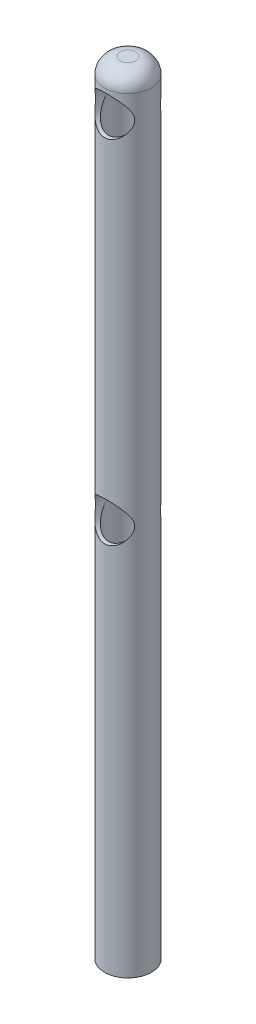
from build123d import *

# Parameters (mm, degrees)
SKETCH1_R              = 30
BOSS_EXTRUDE1_DEPTH    = 1000
FILLET1_R              = 20
CUT_REVOLVE2_OUTLINE_R = 25
CUT_REVOLVE2_ANGLE     = 2.354832
SKETCH7_R              = 25
CUT_EXTRUDE1_DEPTH     = 950


# Read off the part's stored shape, not the designer's step: Cut-Revolve2
with BuildPart() as part:
    # Sketch1 → Boss-Extrude1 (new body)
    with BuildSketch(Plane(origin=(0, 0, 0), x_dir=(1, 0, 0), z_dir=(0, 1, 0))):
        with Locations(Location((0, 0, 0), (0, 0, 270))):
            Circle(SKETCH1_R)
    extrude(amount=BOSS_EXTRUDE1_DEPTH)

    # Fillet1
    fillet1_edges = [part.edges().sort_by_distance(p)[0] for p in [
        (0, 1000, -30),
    ]]
    fillet(fillet1_edges, radius=FILLET1_R)

    # Cut-Revolve2 outline → Cut-Revolve2 (revolve, cut)
    with BuildSketch(Plane(origin=(1460, 0, 0), x_dir=(-0.9997888580919323, 0, -0.02054846065353862), z_dir=(0.02054846065353862, 0, -0.9997888580919323))):
        with Locations((1460, 500)):
            Circle(CUT_REVOLVE2_OUTLINE_R)
        with Locations((1460, 950)):
            Circle(CUT_REVOLVE2_OUTLINE_R)
    revolve(axis=Axis((1460, 0, 0), (0, 1, 0)), revolution_arc=CUT_REVOLVE2_ANGLE, mode=Mode.SUBTRACT)

    # Sketch7 → Cut-Extrude1 (cut)
    with BuildSketch(Plane(origin=(0, 0, 0), x_dir=(-1, 0, 0), z_dir=(0, -1, 0))):
        Circle(SKETCH7_R)
    extrude(amount=-CUT_EXTRUDE1_DEPTH, mode=Mode.SUBTRACT)


solid = part.part
